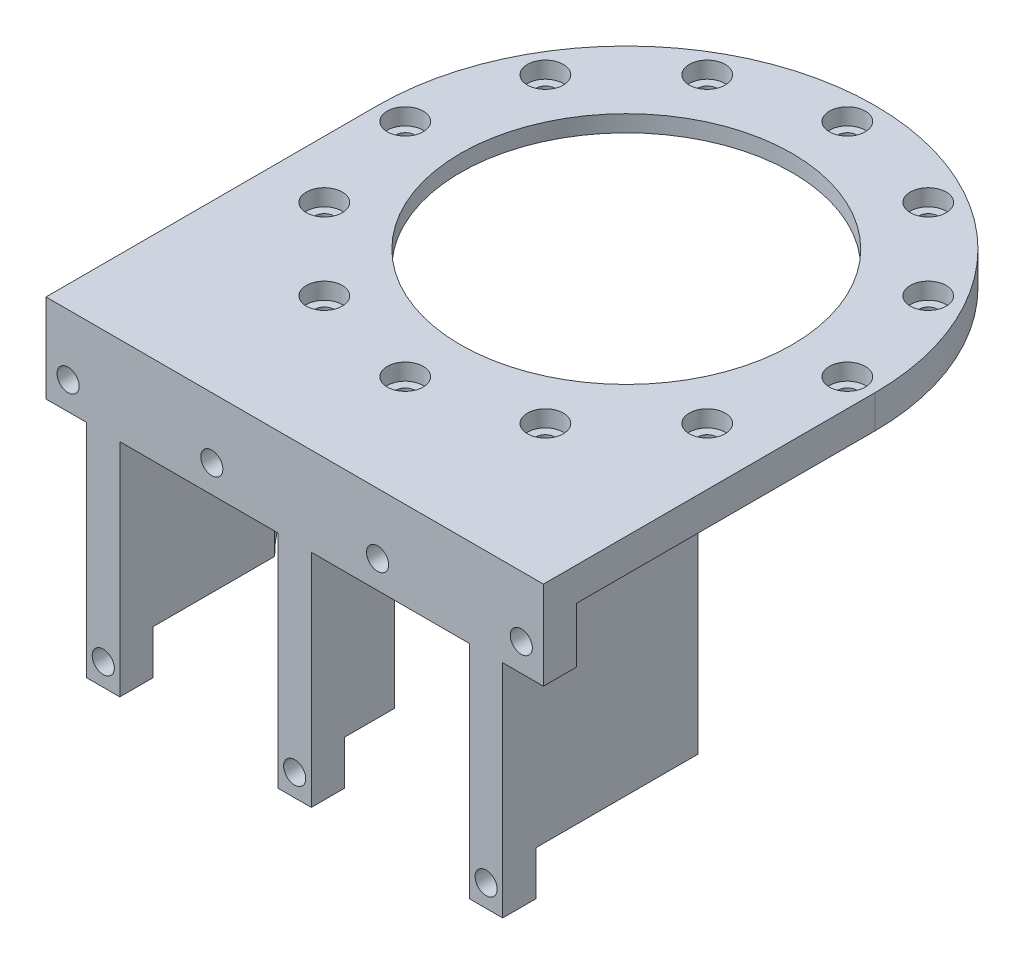
from build123d import *

# Parameters (mm, degrees)
SKETCH1_R           = 45
SKETCH1_R_2         = 30
SKETCH1_R_3         = 1.75
BOSS_EXTRUDE1_DEPTH = 6
SKETCH2_R           = 36
CUT_EXTRUDE1_DEPTH  = 3
SKETCH3_R           = 3.25
CUT_EXTRUDE2_DEPTH  = 3
BOSS_EXTRUDE4_DEPTH = 6
SKETCH5_W           = 90
SKETCH5_H           = 6
BOSS_EXTRUDE6_DEPTH = 10
BOSS_EXTRUDE7_START = 50
BOSS_EXTRUDE7_DEPTH = 50
SKETCH7_W           = 29.339223388
SKETCH7_H           = 8
CUT_EXTRUDE3_DEPTH  = 114.708124382
SKETCH8_R           = 2
CUT_EXTRUDE5_DEPTH  = 120.691269523


with BuildPart() as part:
    # Sketch1 → Boss-Extrude1 (new body)
    with BuildSketch(Plane(origin=(0, 0, 0), x_dir=(1, 0, 0), z_dir=(0, 1, 0))):
        Circle(SKETCH1_R)
        Circle(SKETCH1_R_2, mode=Mode.SUBTRACT)
        with Locations((0, 40)):
            Circle(SKETCH1_R_3, mode=Mode.SUBTRACT)
        with Locations((20, 34.641016151)):
            Circle(SKETCH1_R_3, mode=Mode.SUBTRACT)
        with Locations((34.641016151, 20)):
            Circle(SKETCH1_R_3, mode=Mode.SUBTRACT)
        with Locations((40, 0)):
            Circle(SKETCH1_R_3, mode=Mode.SUBTRACT)
        with Locations((34.641016151, -20)):
            Circle(SKETCH1_R_3, mode=Mode.SUBTRACT)
        with Locations((20, -34.641016151)):
            Circle(SKETCH1_R_3, mode=Mode.SUBTRACT)
        with Locations((0, -40)):
            Circle(SKETCH1_R_3, mode=Mode.SUBTRACT)
        with Locations((-20, -34.641016151)):
            Circle(SKETCH1_R_3, mode=Mode.SUBTRACT)
        with Locations((-34.641016151, -20)):
            Circle(SKETCH1_R_3, mode=Mode.SUBTRACT)
        with Locations((-40, 0)):
            Circle(SKETCH1_R_3, mode=Mode.SUBTRACT)
        with Locations((-34.641016151, 20)):
            Circle(SKETCH1_R_3, mode=Mode.SUBTRACT)
        with Locations((-20, 34.641016151)):
            Circle(SKETCH1_R_3, mode=Mode.SUBTRACT)
    extrude(amount=BOSS_EXTRUDE1_DEPTH)

    # Sketch2 → Cut-Extrude1 (cut)
    with BuildSketch(Plane.XZ):
        Circle(SKETCH2_R)
    extrude(amount=-CUT_EXTRUDE1_DEPTH, mode=Mode.SUBTRACT)

    # Sketch3 → Cut-Extrude2 (cut)
    with BuildSketch(Plane(origin=(0, 6, 0), x_dir=(1, 0, 0), z_dir=(0, 1, 0))):
        with Locations((40, 0)):
            Circle(SKETCH3_R)
        with Locations((34.641016151, -20)):
            Circle(SKETCH3_R)
        with Locations((20, -34.641016151)):
            Circle(SKETCH3_R)
        with Locations((0, -40)):
            Circle(SKETCH3_R)
        with Locations((-20, -34.641016151)):
            Circle(SKETCH3_R)
        with Locations((-34.641016151, -20)):
            Circle(SKETCH3_R)
        with Locations((-40, 0)):
            Circle(SKETCH3_R)
        with Locations((-34.641016151, 20)):
            Circle(SKETCH3_R)
        with Locations((-20, 34.641016151)):
            Circle(SKETCH3_R)
        with Locations((0, 40)):
            Circle(SKETCH3_R)
        with Locations((20, 34.641016151)):
            Circle(SKETCH3_R)
        with Locations((34.641016151, 20)):
            Circle(SKETCH3_R)
    extrude(amount=-CUT_EXTRUDE2_DEPTH, mode=Mode.SUBTRACT)

    # Sketch4 → Boss-Extrude4 (add)
    with BuildSketch(Plane.XZ):
        with BuildLine():
            Line((45, 0), (45, 60))
            Line((45, 60), (-45, 60))
            Line((-45, 60), (-45, 0))
            ThreePointArc((-45, 0), (0, 45), (45, 0))
        make_face()
    extrude(amount=-BOSS_EXTRUDE4_DEPTH)

    # Sketch5 → Boss-Extrude6 (add)
    with BuildSketch(Plane.XZ):
        with Locations((0, 57)):
            Rectangle(SKETCH5_W, SKETCH5_H)
    extrude(amount=BOSS_EXTRUDE6_DEPTH)

    # Sketch6 → Boss-Extrude7 (add)
    with BuildSketch(Plane.XZ.offset(BOSS_EXTRUDE7_START)):
        with BuildLine():
            Line((37.641016151, 24.660776612), (37.641016151, 60))
            Line((37.641016151, 60), (31.641016151, 60))
            Line((31.641016151, 60), (31.641016151, 31.997595174))
            ThreePointArc((31.641016151, 31.997595174), (34.834712955, 28.487589813), (37.641016151, 24.660776612))
        make_face()
        with BuildLine():
            Line((-3, 60), (3, 60))
            Line((3, 60), (3, 44.899888641))
            ThreePointArc((3, 44.899888641), (0, 45), (-3, 44.899888641))
            Line((-3, 44.899888641), (-3, 60))
        make_face()
        with BuildLine():
            Line((-31.641016151, 60), (-31.641016151, 31.997595174))
            ThreePointArc((-31.641016151, 31.997595174), (-34.834712955, 28.487589813), (-37.641016151, 24.660776612))
            Line((-37.641016151, 24.660776612), (-37.641016151, 60))
            Line((-37.641016151, 60), (-31.641016151, 60))
        make_face()
    extrude(amount=-BOSS_EXTRUDE7_DEPTH)

    # Sketch7 → Cut-Extrude3 (cut, through all)
    with BuildSketch(Plane(origin=(37.641016151, 0, 0), x_dir=(0, 0, -1), z_dir=(1, 0, 0))):
        with Locations((-39.330388306, -46)):
            Rectangle(SKETCH7_W, SKETCH7_H)
    extrude(amount=-CUT_EXTRUDE3_DEPTH, mode=Mode.SUBTRACT)

    # Sketch8 → Cut-Extrude5 (cut, through all)
    with BuildSketch(Plane(origin=(0, 0, 54), x_dir=(-1, 0, 0), z_dir=(0, 0, -1))):
        with Locations((41, -5)):
            Circle(SKETCH8_R)
        with Locations((34.641016151, -46)):
            Circle(SKETCH8_R)
        with Locations((0, -46)):
            Circle(SKETCH8_R)
        with Locations((15, -5)):
            Circle(SKETCH8_R)
        with Locations((-34.641016151, -46)):
            Circle(SKETCH8_R)
        with Locations((-41, -5)):
            Circle(SKETCH8_R)
        with Locations((-15, -5)):
            Circle(SKETCH8_R)
    extrude(amount=-CUT_EXTRUDE5_DEPTH, mode=Mode.SUBTRACT)


solid = part.part
